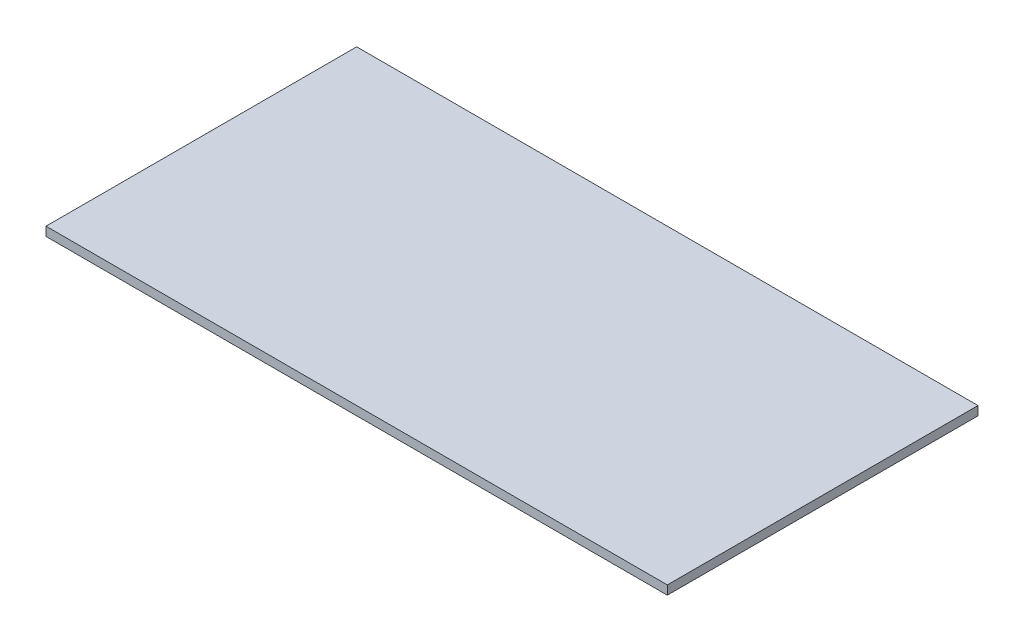
from build123d import *

# Parameters (mm, degrees)
SKETCH1_W           = 1219.2
SKETCH1_H           = 609.6
BOSS_EXTRUDE1_DEPTH = 17.4752


with BuildPart() as part:
    # Sketch1 → Boss-Extrude1 (new body)
    with BuildSketch(Plane(origin=(0, 0, 0), x_dir=(1, 0, 0), z_dir=(0, 1, 0))):
        Rectangle(SKETCH1_W, SKETCH1_H)
    extrude(amount=BOSS_EXTRUDE1_DEPTH)


solid = part.part
